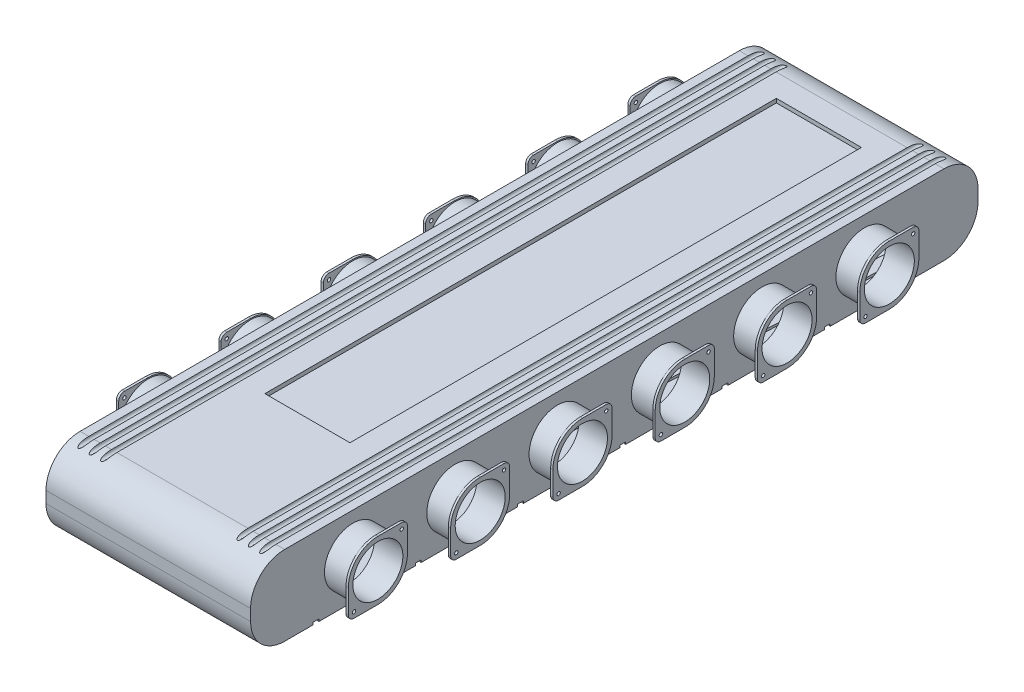
from build123d import *

# Parameters (mm, degrees)
SKETCH1_W           = 180
SKETCH1_H           = 70
BOSS_EXTRUDE1_DEPTH = 640
FILLET1_R           = 30
SKETCH2_W           = 74.84
SKETCH2_H           = 450
CUT_EXTRUDE1_DEPTH  = 3.5
SKETCH3_R           = 25
BOSS_EXTRUDE2_DEPTH = 20
SKETCH4_R           = 1.5
BOSS_EXTRUDE3_DEPTH = 2
LPATTERN1_COUNT     = 6
LPATTERN1_PITCH     = 90
SKETCH5_R           = 25
BOSS_EXTRUDE4_DEPTH = 20
SKETCH6_R           = 1.5
BOSS_EXTRUDE5_DEPTH = 2
LPATTERN2_COUNT     = 6
LPATTERN2_PITCH     = 90
CUT_EXTRUDE2_DEPTH  = 2
SKETCH9_R           = 2.304164522
CUT_EXTRUDE3_DEPTH  = 675.762180327
SHELL1_START        = 5
SHELL1_OUTLINE_W    = 174
SHELL1_OUTLINE_H    = 634
SHELL1_DEPTH        = 58.5
SHELL1_START_2      = 3
SHELL1_2_DEPTH      = 64
SHELL1_START_3      = 63.5
SHELL1_3_DEPTH      = 3.5
SHELL1_4_DEPTH      = 2
SHELL1_START_4      = -22
SHELL1_5_OUTLINE_R  = 22
SHELL1_5_DEPTH      = 25
SHELL1_START_5      = 177
SHELL1_6_OUTLINE_R  = 22
SHELL1_6_DEPTH      = 25
SHELL1_7_DEPTH      = 174


with BuildPart() as part:
    # Sketch1 → Boss-Extrude1 (new body)
    with BuildSketch(Plane.XY):
        with Locations((90, 35)):
            Rectangle(SKETCH1_W, SKETCH1_H)
    extrude(amount=BOSS_EXTRUDE1_DEPTH)

    # Fillet1
    fillet1_edges = [part.edges().sort_by_distance(p)[0] for p in [
        (90, 70, 640),
        (90, 70, 0),
        (90, 0, 0),
        (90, 0, 640),
    ]]
    fillet(fillet1_edges, radius=FILLET1_R)

    # Sketch2 → Cut-Extrude1 (cut)
    with BuildSketch(Plane(origin=(0, 70, 0), x_dir=(1, 0, 0), z_dir=(0, 1, 0))):
        with Locations((90, -275)):
            Rectangle(SKETCH2_W, SKETCH2_H)
    extrude(amount=-CUT_EXTRUDE1_DEPTH, mode=Mode.SUBTRACT)

    # Sketch3 → Boss-Extrude2 (add)
    with BuildSketch(Plane(origin=(180, 0, 0), x_dir=(0, 0, -1), z_dir=(1, 0, 0))):
        with Locations(Location((-550, 35, 0), (0, 0, 180))):
            Circle(SKETCH3_R)
    boss_extrude2 = extrude(amount=BOSS_EXTRUDE2_DEPTH)

    # Sketch4 → Boss-Extrude3 (add)
    with BuildSketch(Plane(origin=(200, 0, 0), x_dir=(0, 0, -1), z_dir=(1, 0, 0))):
        with BuildLine():
            Line((-571, 9), (-550, 9))
            ThreePointArc((-550, 9), (-531.615223689, 16.615223689), (-524, 35))
            Line((-524, 35), (-524, 56))
            ThreePointArc((-524, 56), (-525.464466094, 59.535533906), (-529, 61))
            Line((-529, 61), (-550, 61))
            ThreePointArc((-550, 61), (-568.384776311, 53.384776311), (-576, 35))
            Line((-576, 35), (-576, 14))
            ThreePointArc((-576, 14), (-574.535533906, 10.464466094), (-571, 9))
        make_face()
        with Locations((-571, 14)):
            Circle(SKETCH4_R, mode=Mode.SUBTRACT)
        with Locations((-529, 56)):
            Circle(SKETCH4_R, mode=Mode.SUBTRACT)
    boss_extrude3 = extrude(amount=BOSS_EXTRUDE3_DEPTH)

    # LPattern1: Boss-Extrude2, Boss-Extrude3 ×6
    with Locations(*[(0, 0, -i * LPATTERN1_PITCH) for i in range(1, LPATTERN1_COUNT)]):
        add(boss_extrude2)
        add(boss_extrude3)

    # Sketch5 → Boss-Extrude4 (add)
    with BuildSketch(Plane.ZY):
        with Locations(Location((80, 35, 0), (0, 0, 90))):
            Circle(SKETCH5_R)
    boss_extrude4 = extrude(amount=BOSS_EXTRUDE4_DEPTH)

    # Sketch6 → Boss-Extrude5 (add)
    with BuildSketch(Plane.ZY.offset(20)):
        with BuildLine():
            Line((59, 9), (80, 9))
            ThreePointArc((80, 9), (98.384776311, 16.615223689), (106, 35))
            Line((106, 35), (106, 56))
            ThreePointArc((106, 56), (104.535533906, 59.535533906), (101, 61))
            Line((101, 61), (80, 61))
            ThreePointArc((80, 61), (61.615223689, 53.384776311), (54, 35))
            Line((54, 35), (54, 14))
            ThreePointArc((54, 14), (55.464466094, 10.464466094), (59, 9))
        make_face()
        with Locations(Location((101, 56, 0), (0, 0, 270))):
            Circle(SKETCH6_R, mode=Mode.SUBTRACT)
        with Locations(Location((59, 14, 0), (0, 0, 270))):
            Circle(SKETCH6_R, mode=Mode.SUBTRACT)
    boss_extrude5 = extrude(amount=BOSS_EXTRUDE5_DEPTH)

    # LPattern2: Boss-Extrude4, Boss-Extrude5 ×6
    with Locations(*[(0, 0, i * LPATTERN2_PITCH) for i in range(1, LPATTERN2_COUNT)]):
        add(boss_extrude4)
        add(boss_extrude5)

    # Sketch8 → Cut-Extrude2 (cut)
    with BuildSketch(Plane.XZ):
        Polygon((128.230591568, 124.247843508), (153.061860273, 127.006873364), (158.697951504, 30), (163.706383395, 30), (158.038167383, 127.559796376), (180, 130), (180, 135.030769521), (157.747754866, 132.55829784), (152.842714395, 216.982523822), (180, 220), (180, 225.030769521), (152.552301878, 221.981025285), (147.647261408, 306.405251268), (180, 310), (180, 315.030769521), (147.356848891, 311.403752731), (142.45180842, 395.827978713), (180, 400), (180, 405.030769521), (142.161395903, 400.826480177), (137.256355432, 485.250706159), (180, 490), (180, 495.030769521), (136.965942915, 490.249207623), (132.060902445, 574.673433605), (180, 580), (180, 585.030769521), (131.770489928, 579.671935069), (130.008431891, 610), (125, 610), (126.794182817, 579.119012056), (101.962914112, 576.3599822), (100.008431891, 610), (95, 610), (96.986607002, 575.807059188), (72.155338297, 573.048029332), (70.008431891, 610), (65, 610), (67.179031187, 572.49510632), (42.347762482, 569.736076464), (40.008431891, 610), (35, 610), (37.371455372, 569.183153451), (12.540186667, 566.424123595), (10.008431891, 610), (5, 610), (7.563879556, 565.871200583), (0, 565.030769521), (0, 560), (7.854292073, 560.872699119), (12.759332544, 476.448473137), (0, 475.030769521), (0, 470), (13.049745061, 471.449971673), (17.954785532, 387.025745691), (0, 385.030769521), (0, 380), (18.245198049, 382.027244228), (23.150238519, 297.603018246), (0, 295.030769521), (0, 290), (23.440651036, 292.604516782), (28.345691507, 208.1802908), (0, 205.030769521), (0, 200), (28.636104024, 203.181789336), (33.541144495, 118.757563354), (0, 115.030769521), (0, 110), (33.831557012, 113.75906189), (38.697951504, 30), (43.706383395, 30), (38.807864122, 114.311984902), (63.639132827, 117.071014759), (68.697951504, 30), (73.706383395, 30), (68.615439937, 117.623937771), (93.446708642, 120.382967627), (98.697951504, 30), (103.706383395, 30), (98.423015752, 120.935890639), (123.254284457, 123.694920495), (128.697951504, 30), (133.706383395, 30), align=None)
        Polygon((63.34872031, 122.069516222), (38.517451605, 119.310486366), (33.612411134, 203.734712348), (58.443679839, 206.493742204), align=None, mode=Mode.SUBTRACT)
        Polygon((93.156296125, 125.381469091), (68.32502742, 122.622439235), (63.41998695, 207.046665217), (88.251255655, 209.805695073), align=None, mode=Mode.SUBTRACT)
        Polygon((58.153267322, 211.492243668), (33.321998617, 208.733213812), (28.416958147, 293.157439794), (53.248226852, 295.91646965), align=None, mode=Mode.SUBTRACT)
        Polygon((52.957814335, 300.914971114), (28.12654563, 298.155941258), (23.221505159, 382.58016724), (48.052773864, 385.339197096), align=None, mode=Mode.SUBTRACT)
        Polygon((83.055802667, 299.228422519), (87.960843137, 214.804196536), (63.129574432, 212.04516668), (58.224533962, 296.469392662), align=None, mode=Mode.SUBTRACT)
        Polygon((77.860349679, 388.651149964), (82.76539015, 304.226923982), (57.934121445, 301.467894126), (53.029080974, 385.892120108), align=None, mode=Mode.SUBTRACT)
        Polygon((122.96387194, 128.693421959), (98.132603235, 125.934392103), (93.227562765, 210.358618085), (118.05883147, 213.117647941), align=None, mode=Mode.SUBTRACT)
        Polygon((152.771447756, 132.005374827), (127.940179051, 129.246344971), (123.03513858, 213.670570953), (147.866407285, 216.429600809), align=None, mode=Mode.SUBTRACT)
        Polygon((112.863378482, 302.540375387), (117.768418953, 218.116149405), (92.937150248, 215.357119549), (88.032109777, 299.781345531), align=None, mode=Mode.SUBTRACT)
        Polygon((147.575994768, 221.428102273), (122.744726063, 218.669072417), (117.839685592, 303.093298399), (142.670954297, 305.852328255), align=None, mode=Mode.SUBTRACT)
        Polygon((47.762361347, 390.33769856), (22.931092642, 387.578668704), (18.026052171, 472.002894686), (42.857320876, 474.761924542), align=None, mode=Mode.SUBTRACT)
        Polygon((72.664896692, 478.07387741), (77.569937162, 393.649651428), (52.738668457, 390.890621572), (47.833627987, 475.314847554), align=None, mode=Mode.SUBTRACT)
        Polygon((42.566908359, 479.760426006), (17.735639654, 477.001396149), (12.830599184, 561.425622132), (37.661867889, 564.184651988), align=None, mode=Mode.SUBTRACT)
        Polygon((72.374484175, 483.072378874), (47.54321547, 480.313349018), (42.638174999, 564.737575), (67.469443704, 567.496604856), align=None, mode=Mode.SUBTRACT)
        Polygon((107.667925495, 391.963102833), (112.572965965, 307.538876851), (87.74169726, 304.779846995), (82.83665679, 389.204072977), align=None, mode=Mode.SUBTRACT)
        Polygon((102.472472507, 481.385830279), (107.377512977, 396.961604296), (82.546244272, 394.20257444), (77.641203802, 478.626800422), align=None, mode=Mode.SUBTRACT)
        Polygon((142.38054178, 310.850829719), (117.549273075, 308.091799863), (112.644232605, 392.516025845), (137.47550131, 395.275055701), align=None, mode=Mode.SUBTRACT)
        Polygon((137.185088793, 400.273557165), (112.353820088, 397.514527309), (107.448779617, 481.938753291), (132.280048322, 484.697783147), align=None, mode=Mode.SUBTRACT)
        Polygon((102.18205999, 486.384331742), (77.350791285, 483.625301886), (72.445750814, 568.049527868), (97.277019519, 570.808557724), align=None, mode=Mode.SUBTRACT)
        Polygon((131.989635805, 489.696284611), (107.1583671, 486.937254755), (102.25332663, 571.361480737), (127.084595335, 574.120510593), align=None, mode=Mode.SUBTRACT)
    extrude(amount=-CUT_EXTRUDE2_DEPTH, mode=Mode.SUBTRACT)

    # Sketch9 → Cut-Extrude3 (cut, through all)
    with BuildSketch(Plane(origin=(0, 0, 0), x_dir=(-1, 0, 0), z_dir=(0, 0, -1))):
        with Locations((-170, 70)):
            Circle(SKETCH9_R)
        with Locations((-160, 70)):
            Circle(SKETCH9_R)
        with Locations((-150, 70)):
            Circle(SKETCH9_R)
        with Locations((-30, 70)):
            Circle(SKETCH9_R)
        with Locations((-20, 70)):
            Circle(SKETCH9_R)
        with Locations((-10, 70)):
            Circle(SKETCH9_R)
    extrude(amount=-CUT_EXTRUDE3_DEPTH, mode=Mode.SUBTRACT)

    # Shell1: read off the stored shape, not the designer's step
    # Shell1 outline → Shell1 (cut)
    with BuildSketch(Plane(origin=(0, 0, 0), x_dir=(1, 0, 0), z_dir=(0, 1, 0)).offset(SHELL1_START)):
        with Locations((90, -320)):
            Rectangle(SHELL1_OUTLINE_W, SHELL1_OUTLINE_H)
    extrude(amount=SHELL1_DEPTH, mode=Mode.SUBTRACT)

    # Shell1 2 outline → Shell1 2 (cut)
    with BuildSketch(Plane(origin=(0, 0, 0), x_dir=(1, 0, 0), z_dir=(0, 1, 0)).offset(SHELL1_START_2)):
        Polygon((3, -613), (3, -637), (177, -637), (177, -587.715897901), (134.582026684, -583.002789754), (132.839191276, -613), (121.820641116, -613), (123.634151041, -581.786359127), (104.774450868, -579.690836886), (102.839191276, -613), (91.820641116, -613), (93.826575226, -578.474406259), (74.966875053, -576.378884018), (72.839191276, -613), (61.820641116, -613), (64.01899941, -575.162453391), (45.159299238, -573.066931149), (42.839191276, -613), (31.820641116, -613), (34.211423595, -571.850500522), (15.351723423, -569.754978281), (12.839191276, -613), align=None)
        Polygon((3, -568.382564567), (3, -592.701194819), (4.40384778, -568.538547654), align=None)
        Polygon((135.220934221, -572.006086534), (177, -576.648204954), (177, -497.715897901), (139.777479671, -493.580062308), align=None)
        Polygon((3, -478.382564567), (3, -557.314871621), (5.042755318, -557.541844434), (9.599300768, -479.115820208), align=None)
        Polygon((140.416387209, -482.583359088), (177, -486.648204954), (177, -407.715897901), (144.972932659, -404.157334863), align=None)
        Polygon((3, -388.382564567), (3, -467.314871621), (10.238208305, -468.119116988), (14.794753755, -389.693092762), align=None)
        Polygon((145.611840197, -393.160631642), (177, -396.648204954), (177, -317.715897901), (150.168385647, -314.734607417), align=None)
        Polygon((3, -298.382564567), (3, -377.314871621), (15.433661293, -378.696389542), (19.990206743, -300.270365316), align=None)
        Polygon((150.807293184, -303.737904197), (177, -306.648204954), (177, -227.715897901), (155.363838634, -225.311879971), align=None)
        Polygon((3, -208.382564567), (3, -287.314871621), (20.629114281, -289.273662096), (25.185659731, -210.847637871), align=None)
        Polygon((156.002746172, -214.315176751), (177, -216.648204954), (177, -137.715897901), (160.559291622, -135.889152525), align=None)
        Polygon((3, -118.382564567), (3, -197.314871621), (25.824567268, -199.85093465), (30.381112718, -121.424910425), align=None)
        Polygon((161.198199159, -124.892449305), (177, -126.648204954), (177, -3), (3, -3), (3, -107.314871621), (31.020020256, -110.428207205), (35.867192119, -27), (46.885742279, -27), (41.967895898, -111.644637832), (49.58, -112.490427176), (49.58, -47), (64.705193791, -47), (65.867192119, -27), (76.885742279, -27), (75.723743951, -47), (94.705193791, -47), (95.867192119, -27), (106.885742279, -27), (105.723743951, -47), (124.705193791, -47), (125.867192119, -27), (136.885742279, -27), (131.390623344, -121.580496437), (150.250323517, -123.676018678), (155.867192119, -27), (166.885742279, -27), align=None)
        Polygon((49.58, -202.490427176), (49.58, -123.558120123), (41.328988361, -122.641341052), (36.772442911, -201.067365277), align=None)
        Polygon((49.58, -292.490427177), (49.58, -213.558120123), (36.133535373, -212.064068498), (31.576989923, -290.490092723), align=None)
        Polygon((130.751715807, -132.577199657), (130.42, -138.286602142), (130.42, -211.472649398), (145.054870529, -213.098746124), (149.611415979, -134.672721898), align=None)
        Polygon((49.58, -307.330732495), (49.58, -303.558120123), (30.938082385, -301.486795943), (26.381536935, -379.912820169), (45.241237108, -382.00834241), align=None)
        Polygon((144.415962992, -224.095449344), (130.42, -222.540342345), (130.42, -301.472649398), (139.859417542, -302.52147357), align=None)
        Polygon((49.58, -503), (49.58, -496.979028832), (45.798206775, -562.070227929), (64.657906948, -564.16575017), (68.211631919, -503), align=None)
        Polygon((139.220510004, -313.51817679), (130.42, -312.540342345), (130.42, -391.472649399), (134.663964554, -391.944201016), align=None)
        Polygon((98.211631918, -503), (79.230182079, -503), (75.605782591, -565.382180797), (94.465482763, -567.477703039), align=None)
        Polygon((134.025057016, -402.940904236), (130.42, -402.540342345), (130.42, -464.990167647), align=None)
        Polygon((128.211631919, -503), (109.230182079, -503), (105.413358406, -568.694133666), (124.273058579, -570.789655907), align=None)
        Polygon((40.04578412, -471.431069856), (44.602329571, -393.005045631), (25.742629398, -390.909523389), (21.186083948, -469.335547615), align=None)
        Polygon((34.850331133, -560.853797302), (39.406876583, -482.427773076), (20.54717641, -480.332250835), (15.99063096, -558.758275061), align=None)
    extrude(amount=SHELL1_2_DEPTH, mode=Mode.SUBTRACT)

    # Shell1 3 outline → Shell1 3 (cut)
    # profile 1 of 3: a face of its own
    with BuildSketch(Plane(origin=(0, 0, 0), x_dir=(1, 0, 0), z_dir=(0, 1, 0)).offset(SHELL1_START_3)):
        Polygon((3, -592.701194819), (3, -613), (12.839191276, -613), (15.351723423, -569.754978281), (34.211423595, -571.850500522), (31.820641116, -613), (42.839191276, -613), (45.159299238, -573.066931149), (64.01899941, -575.162453391), (61.820641116, -613), (72.839191276, -613), (74.966875053, -576.378884018), (93.826575226, -578.474406259), (91.820641116, -613), (102.839191276, -613), (104.774450868, -579.690836886), (123.634151041, -581.786359127), (121.820641116, -613), (132.839191276, -613), (134.582026684, -583.002789754), (177, -587.715897901), (177, -576.648204954), (135.220934221, -572.006086534), (139.777479671, -493.580062308), (177, -497.715897901), (177, -486.648204954), (140.416387209, -482.583359088), (144.972932659, -404.157334863), (177, -407.715897901), (177, -396.648204954), (145.611840197, -393.160631642), (150.168385647, -314.734607417), (177, -317.715897901), (177, -306.648204954), (150.807293184, -303.737904197), (155.363838634, -225.311879971), (177, -227.715897901), (177, -216.648204954), (156.002746172, -214.315176751), (160.559291622, -135.889152525), (177, -137.715897901), (177, -126.648204954), (161.198199159, -124.892449305), (166.885742279, -27), (155.867192119, -27), (150.250323517, -123.676018678), (131.390623344, -121.580496437), (136.885742279, -27), (125.867192119, -27), (124.705193791, -47), (130.42, -47), (130.42, -138.286602142), (130.751715807, -132.577199657), (149.611415979, -134.672721898), (145.054870529, -213.098746124), (130.42, -211.472649398), (130.42, -222.540342345), (144.415962992, -224.095449344), (139.859417542, -302.52147357), (130.42, -301.472649398), (130.42, -312.540342345), (139.220510004, -313.51817679), (134.663964554, -391.944201016), (130.42, -391.472649399), (130.42, -402.540342345), (134.025057016, -402.940904236), (130.42, -464.990167647), (130.42, -503), (128.211631919, -503), (124.273058579, -570.789655907), (105.413358406, -568.694133666), (109.230182079, -503), (98.211631918, -503), (94.465482763, -567.477703039), (75.605782591, -565.382180797), (79.230182079, -503), (68.211631919, -503), (64.657906948, -564.16575017), (45.798206775, -562.070227929), (49.58, -496.979028832), (49.58, -307.330732495), (45.241237108, -382.00834241), (26.381536935, -379.912820169), (30.938082385, -301.486795943), (49.58, -303.558120123), (49.58, -292.490427177), (31.576989923, -290.490092723), (36.133535373, -212.064068498), (49.58, -213.558120123), (49.58, -202.490427176), (36.772442911, -201.067365277), (41.328988361, -122.641341052), (49.58, -123.558120123), (49.58, -112.490427176), (41.967895898, -111.644637832), (46.885742279, -27), (35.867192119, -27), (31.020020256, -110.428207205), (3, -107.314871621), (3, -118.382564567), (30.381112718, -121.424910425), (25.824567268, -199.85093465), (3, -197.314871621), (3, -208.382564567), (25.185659731, -210.847637871), (20.629114281, -289.273662096), (3, -287.314871621), (3, -298.382564567), (19.990206743, -300.270365316), (15.433661293, -378.696389542), (3, -377.314871621), (3, -388.382564567), (14.794753755, -389.693092762), (10.238208305, -468.119116988), (3, -467.314871621), (3, -478.382564567), (9.599300768, -479.115820208), (5.042755318, -557.541844434), (3, -557.314871621), (3, -568.382564567), (4.40384778, -568.538547654), align=None)
        Polygon((20.54717641, -480.332250835), (39.406876583, -482.427773076), (34.850331133, -560.853797302), (15.99063096, -558.758275061), align=None, mode=Mode.SUBTRACT)
        Polygon((25.742629398, -390.909523389), (44.602329571, -393.005045631), (40.04578412, -471.431069856), (21.186083948, -469.335547615), align=None, mode=Mode.SUBTRACT)
    # profile 2 of 3: a face of its own
    with BuildSketch(Plane(origin=(0, 0, 0), x_dir=(1, 0, 0), z_dir=(0, 1, 0)).offset(SHELL1_START_3)):
        Polygon((65.867192119, -27), (64.705193791, -47), (75.723743951, -47), (76.885742279, -27), align=None)
    # profile 3 of 3: a face of its own
    with BuildSketch(Plane(origin=(0, 0, 0), x_dir=(1, 0, 0), z_dir=(0, 1, 0)).offset(SHELL1_START_3)):
        Polygon((94.705193791, -47), (105.723743951, -47), (106.885742279, -27), (95.867192119, -27), align=None)
    extrude(amount=SHELL1_3_DEPTH, mode=Mode.SUBTRACT)

    # Shell1 4 outline → Shell1 4 (cut)
    with BuildSketch(Plane(origin=(0, 0, 0), x_dir=(1, 0, 0), z_dir=(0, 1, 0)).offset(SHELL1_START_2)):
        Polygon((49.58, -47), (49.58, -112.490427176), (60.827596071, -113.740160073), (64.705193791, -47), align=None)
        Polygon((60.188688533, -124.736863293), (49.58, -123.558120123), (49.58, -202.490427176), (55.632143083, -203.162887519), align=None)
        Polygon((120.442747702, -120.36406581), (124.705193791, -47), (105.723743951, -47), (101.583047529, -118.268543568), align=None)
        Polygon((94.705193791, -47), (75.723743951, -47), (71.775471714, -114.9565907), (90.635171886, -117.052112941), align=None)
        Polygon((54.993235546, -214.159590739), (49.58, -213.558120123), (49.58, -292.490427177), (50.436690096, -292.585614965), align=None)
        Polygon((130.42, -211.472649398), (130.42, -138.286602142), (126.195170357, -211.003223882), align=None)
        Polygon((49.797782558, -303.582318185), (49.58, -303.558120123), (49.58, -307.330732495), align=None)
        Polygon((130.42, -301.472649398), (130.42, -222.540342345), (125.556262819, -221.999927103), (120.999717369, -300.425951328), align=None)
        Polygon((50.354752225, -483.644203703), (49.58, -496.979028832), (49.58, -503), (68.211631919, -503), (69.214452398, -485.739725945), align=None)
        Polygon((130.42, -391.472649399), (130.42, -312.540342345), (120.360809831, -311.422654548), (115.804264381, -389.848678774), align=None)
        Polygon((80.162328041, -486.956156572), (79.230182079, -503), (98.211631918, -503), (99.022028213, -489.051678813), align=None)
        Polygon((130.42, -464.990167647), (130.42, -402.540342345), (115.165356844, -400.845381994), (110.608811394, -479.27140622), (129.468511566, -481.366928461), align=None)
        Polygon((109.969903856, -490.26810944), (109.230182079, -503), (128.211631919, -503), (128.829604029, -492.363631682), align=None)
        Polygon((99.660935751, -478.054975593), (104.217481201, -399.628951367), (85.357781028, -397.533429126), (80.801235578, -475.959453352), align=None)
        Polygon((104.856388739, -388.632248147), (109.412934189, -310.206223922), (90.553234016, -308.11070168), (85.996688566, -386.536725906), align=None)
        Polygon((110.051841726, -299.209520701), (114.608387176, -220.783496476), (95.748687004, -218.687974234), (91.192141554, -297.11399846), align=None)
        Polygon((115.247294714, -209.786793256), (119.803840164, -131.36076903), (100.944139991, -129.265246788), (96.387594541, -207.691271014), align=None)
        Polygon((69.853359936, -474.743022725), (74.409905386, -396.316998499), (55.550205213, -394.221476258), (50.993659763, -472.647500483), align=None)
        Polygon((75.048812923, -385.320295279), (79.605358373, -306.894271053), (60.745658201, -304.798748812), (56.189112751, -383.224773037), align=None)
        Polygon((80.244265911, -295.897567833), (84.800811361, -217.471543607), (65.941111188, -215.376021366), (61.384565738, -293.802045592), align=None)
        Polygon((85.439718899, -206.474840387), (89.996264349, -128.048816162), (71.136564176, -125.95329392), (66.580018726, -204.379318146), align=None)
    extrude(amount=SHELL1_4_DEPTH, mode=Mode.SUBTRACT)

    # Shell1 5 outline → Shell1 5 (cut)
    with BuildSketch(Plane.YZ.offset(SHELL1_START_4)):
        with Locations((35, 530)):
            Circle(SHELL1_5_OUTLINE_R)
        with Locations((35, 440)):
            Circle(SHELL1_5_OUTLINE_R)
        with Locations((35, 350)):
            Circle(SHELL1_5_OUTLINE_R)
        with Locations((35, 260)):
            Circle(SHELL1_5_OUTLINE_R)
        with Locations((35, 80)):
            Circle(SHELL1_5_OUTLINE_R)
        with Locations((35, 170)):
            Circle(SHELL1_5_OUTLINE_R)
    extrude(amount=SHELL1_5_DEPTH, mode=Mode.SUBTRACT)

    # Shell1 6 outline → Shell1 6 (cut)
    with BuildSketch(Plane.YZ.offset(SHELL1_START_5)):
        with Locations((35, 550)):
            Circle(SHELL1_6_OUTLINE_R)
        with Locations((35, 460)):
            Circle(SHELL1_6_OUTLINE_R)
        with Locations((35, 370)):
            Circle(SHELL1_6_OUTLINE_R)
        with Locations((35, 280)):
            Circle(SHELL1_6_OUTLINE_R)
        with Locations((35, 100)):
            Circle(SHELL1_6_OUTLINE_R)
        with Locations((35, 190)):
            Circle(SHELL1_6_OUTLINE_R)
    extrude(amount=SHELL1_6_DEPTH, mode=Mode.SUBTRACT)

    # Shell1 7 outline → Shell1 7 (add)
    with BuildSketch(Plane.YZ.offset(SHELL1_START_2)):
        with BuildLine():
            Line((3, 30), (3, 16.923303169))
            ThreePointArc((3, 16.923303169), (8.786796564, 8.786796564), (16.923303169, 3))
            Line((16.923303169, 3), (30, 3))
            ThreePointArc((30, 3), (10.908116908, 10.908116908), (3, 30))
        make_face()
        with BuildLine():
            ThreePointArc((3, 610), (10.908116908, 629.091883092), (30, 637))
            Line((30, 637), (16.923303169, 637))
            ThreePointArc((16.923303169, 637), (8.786796564, 631.213203436), (3, 623.076696831))
            Line((3, 623.076696831), (3, 610))
        make_face()
        with BuildLine():
            ThreePointArc((40, 637), (59.091883092, 629.091883092), (67, 610))
            Line((67, 610), (67, 623.076696831))
            ThreePointArc((67, 623.076696831), (61.213203436, 631.213203436), (53.076696831, 637))
            Line((53.076696831, 637), (40, 637))
        make_face()
        with BuildLine():
            ThreePointArc((67, 30), (59.091883092, 10.908116908), (40, 3))
            Line((40, 3), (53.076696831, 3))
            ThreePointArc((53.076696831, 3), (61.213203436, 8.786796564), (67, 16.923303169))
            Line((67, 16.923303169), (67, 30))
        make_face()
    extrude(amount=SHELL1_7_DEPTH)

    # Shell1 8: loft between two sections, ruled curve by curve
    shell1_8_from = [
        Edge.make_three_point_arc((14.374261226, 67, 620.915534795), (10, 64.695835478, 620.915534795), (5.625738774, 67, 620.915534795)),
        Edge.make_line((5.625738774, 67, 620.915534795), (14.374261226, 67, 620.915534795)),
    ]
    shell1_8_to = [
        Edge.make_three_point_arc((14.374261226, 67, 19.084465205), (10, 64.695835478, 19.084465205), (5.625738774, 67, 19.084465205)),
        Edge.make_line((5.625738774, 67, 19.084465205), (14.374261226, 67, 19.084465205)),
    ]
    shell1_8 = Solid(Shell([*[Face.make_surface_from_curves(shell1_8_from[k], shell1_8_to[k]) for k in range(2)], Face(Wire(shell1_8_from)), Face(Wire(shell1_8_to))]))
    add(shell1_8)

    # Shell1 9: loft between two sections, ruled curve by curve
    shell1_9_from = [
        Edge.make_three_point_arc((24.374261226, 67, 620.915534795), (20, 64.695835478, 620.915534795), (15.625738774, 67, 620.915534795)),
        Edge.make_line((15.625738774, 67, 620.915534795), (24.374261226, 67, 620.915534795)),
    ]
    shell1_9_to = [
        Edge.make_three_point_arc((24.374261226, 67, 19.084465205), (20, 64.695835478, 19.084465205), (15.625738774, 67, 19.084465205)),
        Edge.make_line((15.625738774, 67, 19.084465205), (24.374261226, 67, 19.084465205)),
    ]
    shell1_9 = Solid(Shell([*[Face.make_surface_from_curves(shell1_9_from[k], shell1_9_to[k]) for k in range(2)], Face(Wire(shell1_9_from)), Face(Wire(shell1_9_to))]))
    add(shell1_9)

    # Shell1 10: loft between two sections, ruled curve by curve
    shell1_10_from = [
        Edge.make_three_point_arc((34.374261226, 67, 620.915534795), (30, 64.695835478, 620.915534795), (25.625738774, 67, 620.915534795)),
        Edge.make_line((25.625738774, 67, 620.915534795), (34.374261226, 67, 620.915534795)),
    ]
    shell1_10_to = [
        Edge.make_three_point_arc((34.374261226, 67, 19.084465205), (30, 64.695835478, 19.084465205), (25.625738774, 67, 19.084465205)),
        Edge.make_line((25.625738774, 67, 19.084465205), (34.374261226, 67, 19.084465205)),
    ]
    shell1_10 = Solid(Shell([*[Face.make_surface_from_curves(shell1_10_from[k], shell1_10_to[k]) for k in range(2)], Face(Wire(shell1_10_from)), Face(Wire(shell1_10_to))]))
    add(shell1_10)

    # Shell1 11: loft between two sections, ruled curve by curve
    shell1_11_from = [
        Edge.make_three_point_arc((154.374261226, 67, 620.915534795), (150, 64.695835478, 620.915534795), (145.625738774, 67, 620.915534795)),
        Edge.make_line((145.625738774, 67, 620.915534795), (154.374261226, 67, 620.915534795)),
    ]
    shell1_11_to = [
        Edge.make_three_point_arc((154.374261226, 67, 19.084465205), (150, 64.695835478, 19.084465205), (145.625738774, 67, 19.084465205)),
        Edge.make_line((145.625738774, 67, 19.084465205), (154.374261226, 67, 19.084465205)),
    ]
    shell1_11 = Solid(Shell([*[Face.make_surface_from_curves(shell1_11_from[k], shell1_11_to[k]) for k in range(2)], Face(Wire(shell1_11_from)), Face(Wire(shell1_11_to))]))
    add(shell1_11)

    # Shell1 12: loft between two sections, ruled curve by curve
    shell1_12_from = [
        Edge.make_three_point_arc((164.374261226, 67, 620.915534795), (160, 64.695835478, 620.915534795), (155.625738774, 67, 620.915534795)),
        Edge.make_line((155.625738774, 67, 620.915534795), (164.374261226, 67, 620.915534795)),
    ]
    shell1_12_to = [
        Edge.make_three_point_arc((164.374261226, 67, 19.084465205), (160, 64.695835478, 19.084465205), (155.625738774, 67, 19.084465205)),
        Edge.make_line((155.625738774, 67, 19.084465205), (164.374261226, 67, 19.084465205)),
    ]
    shell1_12 = Solid(Shell([*[Face.make_surface_from_curves(shell1_12_from[k], shell1_12_to[k]) for k in range(2)], Face(Wire(shell1_12_from)), Face(Wire(shell1_12_to))]))
    add(shell1_12)

    # Shell1 13: loft between two sections, ruled curve by curve
    shell1_13_from = [
        Edge.make_three_point_arc((174.374261226, 67, 620.915534795), (170, 64.695835478, 620.915534795), (165.625738774, 67, 620.915534795)),
        Edge.make_line((165.625738774, 67, 620.915534795), (174.374261226, 67, 620.915534795)),
    ]
    shell1_13_to = [
        Edge.make_three_point_arc((174.374261226, 67, 19.084465205), (170, 64.695835478, 19.084465205), (165.625738774, 67, 19.084465205)),
        Edge.make_line((165.625738774, 67, 19.084465205), (174.374261226, 67, 19.084465205)),
    ]
    shell1_13 = Solid(Shell([*[Face.make_surface_from_curves(shell1_13_from[k], shell1_13_to[k]) for k in range(2)], Face(Wire(shell1_13_from)), Face(Wire(shell1_13_to))]))
    add(shell1_13)


solid = part.part
